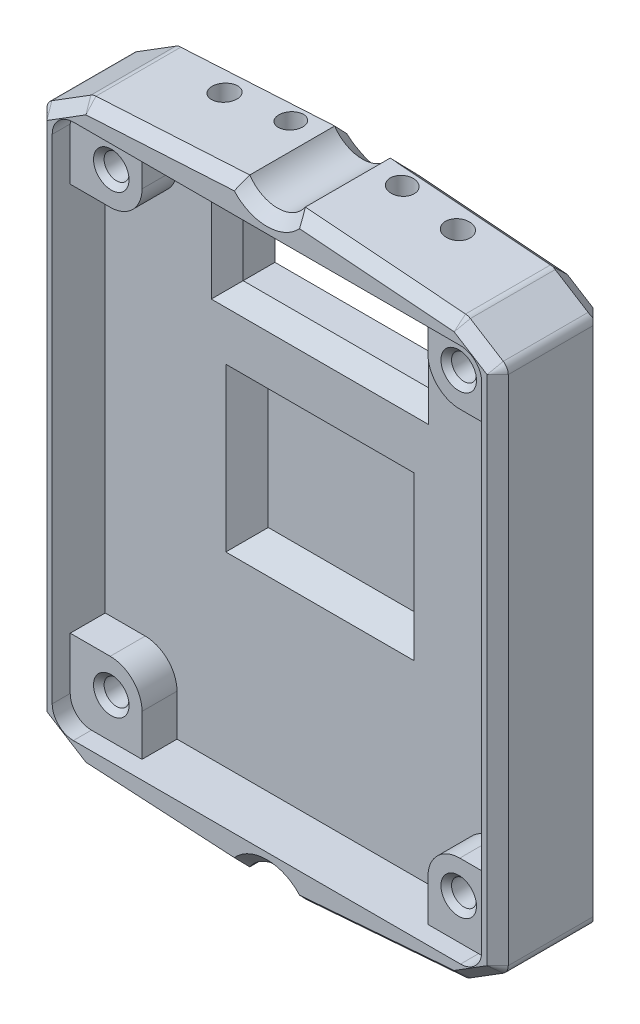
from build123d import *
from OCP.BRepFilletAPI import BRepFilletAPI_MakeChamfer

# Parameters (mm, degrees)
SKETCH1_W               = 46.5
SKETCH1_H               = 56.5
SKETCH1_W_2             = 40.5
SKETCH1_H_2             = 50.5
BOSS_EXTRUDE1_DEPTH     = 5
SKETCH2_W               = 46.5
SKETCH2_H               = 56.5
BOSS_EXTRUDE2_DEPTH     = 6
SKETCH3_W               = 6.769354508
SKETCH3_H               = 6.917814105
SKETCH3_R               = 1.175
BOSS_EXTRUDE3_DEPTH     = 3.3
CHAMFER3_SIZE           = 4.5
CHAMFER3_SIZE2          = 7.201505381
FILLET1_R               = 3
SKETCH4_W               = 17.5
SKETCH4_H               = 10
CUT_EXTRUDE1_DEPTH      = 38.075935592
CUT_EXTRUDE2_DEPTH      = 39.205038935
SKETCH6_W               = 1.5
SKETCH6_H               = 60.377235873
CUT_EXTRUDE3_DEPTH      = 39.205038935
CUT_EXTRUDE4_START      = 30
SKETCH7_R               = 1.125
CUT_EXTRUDE4_DEPTH      = 10
CHAMFER6_SIZE           = 2
FILLET2_R               = 1
CHAMFER1_SIZE           = 1
FILLET3_R               = 2
SKETCH8_R               = 1.175
CUT_EXTRUDE5_DEPTH      = 37.84601894
CUT_EXTRUDE6_DEPTH      = 1
CHAMFER2_SIZE           = 0.5
CHAMFER4_SIZE           = 1
CUT_EXTRUDE7_DEPTH      = 37.154378873
CUT_EXTRUDE7_DEPTH_BACK = 37.154378873
SKETCH10_R              = 1.175
SKETCH11_W              = 17.761064334
SKETCH11_H              = 15.333216528
CUT_EXTRUDE8_DEPTH      = 2
CHAMFER5_SIZE           = 2
CHAMFER7_SIZE           = 1.5


# Some blends are built 0.0001 mm under size
with BuildPart() as part:
    # Sketch1 → Boss-Extrude1 (new body)
    with BuildSketch(Plane.XY):
        Rectangle(SKETCH1_W, SKETCH1_H)
        Rectangle(SKETCH1_W_2, SKETCH1_H_2, mode=Mode.SUBTRACT)
    extrude(amount=BOSS_EXTRUDE1_DEPTH)

    # Sketch2 → Boss-Extrude2 (add)
    with BuildSketch(Plane(origin=(0, 0, 0), x_dir=(-1, 0, 0), z_dir=(0, 0, -1))):
        Rectangle(SKETCH2_W, SKETCH2_H)
    extrude(amount=BOSS_EXTRUDE2_DEPTH)

    # Sketch3 → Boss-Extrude3 (add)
    # profile 1 of 4: a face of its own
    with BuildSketch(Plane.XY):
        with Locations((-16.865322746, 21.791092948)):
            Rectangle(SKETCH3_W, SKETCH3_H)
        with Locations((-16.38, 21.46)):
            Circle(SKETCH3_R, mode=Mode.SUBTRACT)
    # profile 2 of 4: a face of its own
    with BuildSketch(Plane.XY):
        with Locations((16.865322746, 21.791092948)):
            Rectangle(SKETCH3_W, SKETCH3_H)
        with Locations(Location((16.38, 21.46, 0), (0, 0, 180))):
            Circle(SKETCH3_R, mode=Mode.SUBTRACT)
    # profile 3 of 4: a face of its own
    with BuildSketch(Plane.XY):
        with Locations((16.865322746, -21.791092948)):
            Rectangle(SKETCH3_W, SKETCH3_H)
        with Locations((16.38, -21.46)):
            Circle(SKETCH3_R, mode=Mode.SUBTRACT)
    # profile 4 of 4: a face of its own
    with BuildSketch(Plane.XY):
        with Locations((-16.865322746, -21.791092948)):
            Rectangle(SKETCH3_W, SKETCH3_H)
        with Locations(Location((-16.38, -21.46, 0), (0, 0, 180))):
            Circle(SKETCH3_R, mode=Mode.SUBTRACT)
    extrude(amount=BOSS_EXTRUDE3_DEPTH)

    # Chamfer3: one chamfer whose edges measure the first distance from different faces: ONE call of the kernel's chamfer builder (chamfer() names one face for all edges)
    chamfer3_edges_1 = [part.edges().sort_by_distance(p)[0] for p in [
        (23.25, 28.25, -0.5),
        (23.25, -28.25, -0.5),
    ]]
    chamfer3_side_1 = [part.faces().sort_by_distance(p)[0] for p in [
        (23.25, 0, -0.5),
    ]]
    chamfer3_edges_2 = [part.edges().sort_by_distance(p)[0] for p in [
        (-23.25, -28.25, -0.5),
        (-23.25, 28.25, -0.5),
    ]]
    chamfer3_side_2 = [part.faces().sort_by_distance(p)[0] for p in [
        (-23.25, 0, -0.5),
    ]]
    chamfer3 = BRepFilletAPI_MakeChamfer(part.part.solid().wrapped)
    for e in chamfer3_edges_1:
        chamfer3.Add(CHAMFER3_SIZE, CHAMFER3_SIZE2, e.wrapped, chamfer3_side_1[0].wrapped)  # the first distance lies on this face
    for e in chamfer3_edges_2:
        chamfer3.Add(CHAMFER3_SIZE, CHAMFER3_SIZE2, e.wrapped, chamfer3_side_2[0].wrapped)  # the first distance lies on this face
    add(Compound.cast(chamfer3.Shape()), mode=Mode.REPLACE)

    # Fillet1
    fillet1_edges = [part.edges().sort_by_distance(p)[0] for p in [
        (-13.480645492, 18.332185895, 1.65),
        (13.480645492, 18.332185895, 1.65),
        (13.480645492, -18.332185895, 1.65),
        (-13.480645492, -18.332185895, 1.65),
    ]]
    fillet(fillet1_edges, radius=FILLET1_R)

    # Sketch4 → Cut-Extrude1 (cut, through all)
    with BuildSketch(Plane.XY):
        with Locations((0, 18.8)):
            Rectangle(SKETCH4_W, SKETCH4_H)
    extrude(amount=-CUT_EXTRUDE1_DEPTH, mode=Mode.SUBTRACT)

    # Sketch5 → Cut-Extrude2 (cut, through all)
    with BuildSketch(Plane(origin=(0, 0, -6), x_dir=(-1, 0, 0), z_dir=(0, 0, -1))):
        Polygon((-23.25, -26.637996363), (-23.25, -28.25), (-16.048494619, -28.25), (-17.967727773, -27.050730023), align=None)
        with BuildLine():
            ThreePointArc((2.619160171, -28.25), (0, -26.85), (-2.619160171, -28.25))
            Line((-2.619160171, -28.25), (2.619160171, -28.25))
        make_face()
        Polygon((17.383051154, -27.416076523), (16.048494619, -28.25), (23.25, -28.25), (23.25, -27.08468784), align=None)
        Polygon((-17.967727773, -27.050730023), (-16.048494619, -28.25), (-2.619160171, -28.25), align=None)
        Polygon((17.383051154, -27.416076523), (2.619160171, -28.25), (16.048494619, -28.25), align=None)
        Polygon((-17.967727773, 27.050730023), (-2.619160171, 28.25), (-16.048494619, 28.25), align=None)
        Polygon((16.048494619, 28.25), (2.619160171, 28.25), (17.383051154, 27.416076523), align=None)
        Polygon((16.048494619, 28.25), (17.383051154, 27.416076523), (23.25, 27.08468784), (23.25, 28.25), align=None)
        Polygon((-23.25, 26.637996363), (-17.967727773, 27.050730023), (-16.048494619, 28.25), (-23.25, 28.25), align=None)
        with BuildLine():
            Line((2.619160171, 28.25), (-2.619160171, 28.25))
            ThreePointArc((-2.619160171, 28.25), (0, 26.85), (2.619160171, 28.25))
        make_face()
    extrude(amount=-CUT_EXTRUDE2_DEPTH, mode=Mode.SUBTRACT)

    # Sketch6 → Cut-Extrude3 (cut, through all)
    with BuildSketch(Plane.XY.offset(5)):
        with Locations((-22.500324405, 3.019222435)):
            Rectangle(SKETCH6_W, SKETCH6_H)
        with Locations((22.500324405, 3.019222435)):
            Rectangle(SKETCH6_W, SKETCH6_H)
    extrude(amount=-CUT_EXTRUDE3_DEPTH, mode=Mode.SUBTRACT)

    # Sketch7 → Cut-Extrude4 (cut)
    with BuildSketch(Plane(origin=(0, 0, 0), x_dir=(1, 0, 0), z_dir=(0, 1, 0)).offset(CUT_EXTRUDE4_START)):
        with Locations((-5.25, 2.5)):
            Circle(SKETCH7_R)
        with Locations(Location((5.25, 2.5, 0), (0, 0, 180))):
            Circle(SKETCH7_R)
    cut_extrude4 = extrude(amount=-CUT_EXTRUDE4_DEPTH, mode=Mode.SUBTRACT)

    # Mirror1: Cut-Extrude4 across plane
    add(cut_extrude4.mirror(Plane.ZX), mode=Mode.SUBTRACT)

    # Chamfer6
    chamfer6_edges = [part.edges().sort_by_distance(p)[0] for p in [
        (0, -26.85, -6),
        (0, 26.85, -6),
        (19.859026089, 25.86891567, -6),
        (-19.56668778, -26.05158892, -6),
        (-10.001105663, -27.833038261, -6),
        (10.293443972, -27.650365012, -6),
        (10.293443972, 27.650365012, -6),
        (-10.001105663, 27.833038261, -6),
        (19.859026089, -25.86891567, -6),
        (-19.56668778, 26.05158892, -6),
        (-21.750324405, 0, -6),
        (21.750324405, 0, -6),
    ]]
    chamfer(chamfer6_edges, length=CHAMFER6_SIZE)

    # Fillet2
    fillet2_edges = [part.edges().sort_by_distance(p)[0] for p in [
        (-17.383051154, -27.416076523, 0.5),
        (17.967727773, -27.050730023, 0.5),
        (17.967727773, 27.050730023, 0.5),
        (-17.383051154, 27.416076523, 0.5),
        (-21.750324405, 24.687101317, 0.5),
        (21.750324405, -24.687101317, 0.5),
        (-21.750324405, -24.687101317, 0.5),
        (21.750324405, 24.687101317, 0.5),
    ]]
    fillet(fillet2_edges, radius=FILLET2_R)

    # Chamfer1
    # the kernel refuses this chamfer: 1 mm, written as the material it takes off along each edge
    with BuildSketch(Plane(origin=(0, -30, 5), x_dir=(-0.9741455172104229, -0.22592147153123326, 0), z_dir=(0.22592147153123326, -0.9741455172104229, 0))) as chamfer1_piece_1:
        Polygon((3.15 + CHAMFER1_SIZE, 0), (3.15, CHAMFER1_SIZE), (3.15, 0), align=None)
    revolve(axis=Axis((0, -30, 5), (0, 0, -1)), revolution_arc=206.11413982, mode=Mode.SUBTRACT)
    with BuildSketch(Plane(origin=(0, 30, 5), x_dir=(0.9741455172104218, 0.22592147153123757, 0), z_dir=(-0.22592147153123757, 0.9741455172104218, 0))) as chamfer1_piece_2:
        Polygon((3.15 + CHAMFER1_SIZE, 0), (3.15, CHAMFER1_SIZE), (3.15, 0), align=None)
    revolve(axis=Axis((0, 30, 5), (0, 0, -1)), revolution_arc=206.11413982, mode=Mode.SUBTRACT)
    with BuildSketch(Plane(origin=(-21.280243669, 24.980840362, 5), x_dir=(0, 0, -1), z_dir=(0.8480480961564273, 0.5299192642332029, 0)), Plane(origin=(-21.280243669, -24.980840362, 5), x_dir=(0.5299192642332029, 0.8480480961564274, 0), z_dir=(0.8480480961564274, -0.5299192642332028, 0))) as chamfer1_piece_3:
        Polygon((CHAMFER1_SIZE, 0), (0, -CHAMFER1_SIZE), (0, 0), align=None)
    extrude(amount=4.339034518, mode=Mode.SUBTRACT)
    with BuildSketch(Plane(origin=(-17.127008544, 27.430538831, 5), x_dir=(0.056394101048406496, -0.9984085863848238, 0), z_dir=(0.9984085863848239, 0.05639410104840651, 0)), Plane(origin=(-0.051569794, -28.39502775, 5), x_dir=(0.05639410104840633, 0.9984085863848238, 0), z_dir=(-0.9984085863848238, 0.05639410104840633, 0))) as chamfer1_piece_4:
        Polygon((CHAMFER1_SIZE, 0), (0, CHAMFER1_SIZE), (0, 0), align=None)
    extrude(amount=17.10265615, mode=Mode.SUBTRACT)
    with BuildSketch(Plane(origin=(-21.750324405, 24.132792266, 5), x_dir=(1, 0, 0), z_dir=(0, -1, 0))) as chamfer1_piece_5:
        Polygon((CHAMFER1_SIZE, 0), (0, -CHAMFER1_SIZE), (0, 0), align=None)
    extrude(amount=48.265584531, mode=Mode.SUBTRACT)
    with BuildSketch(Plane(origin=(17.723475622, -27.069814818, 5), x_dir=(-0.07789819925091969, 0.9969613184840543, 0), z_dir=(-0.9969613184840543, -0.07789819925091969, 0)), Plane(origin=(0.055291708, 28.450329474, 5), x_dir=(-0.07789819925091988, -0.9969613184840543, 0), z_dir=(0.9969613184840543, -0.0778981992509199, 0))) as chamfer1_piece_6:
        Polygon((CHAMFER1_SIZE, 0), (0, CHAMFER1_SIZE), (0, 0), align=None)
    extrude(amount=17.722035536, mode=Mode.SUBTRACT)
    with BuildSketch(Plane(origin=(21.280243669, -24.980840362, 5), x_dir=(-0.5299192642332028, 0.8480480961564273, 0), z_dir=(-0.8480480961564274, -0.5299192642332029, 0))) as chamfer1_piece_7:
        Polygon((CHAMFER1_SIZE, 0), (0, CHAMFER1_SIZE), (0, 0), align=None)
    extrude(amount=3.661050589, mode=Mode.SUBTRACT)
    with BuildSketch(Plane(origin=(21.750324405, 24.132792266, 5), x_dir=(-1, 0, 0), z_dir=(0, -1, 0))) as chamfer1_piece_8:
        Polygon((CHAMFER1_SIZE, 0), (0, CHAMFER1_SIZE), (0, 0), align=None)
    extrude(amount=48.265584531, mode=Mode.SUBTRACT)
    with BuildSketch(Plane(origin=(21.280243669, 24.980840362, 5), x_dir=(-0.529919264233203, -0.8480480961564272, 0), z_dir=(-0.8480480961564272, 0.529919264233203, 0))) as chamfer1_piece_9:
        Polygon((CHAMFER1_SIZE, 0), (0, -CHAMFER1_SIZE), (0, 0), align=None)
    extrude(amount=3.661050589, mode=Mode.SUBTRACT)
    with BuildSketch(Plane(origin=(20.750324405, 24.132792266, 5), x_dir=(0.5299192642332002, 0.848048096156429, 0), z_dir=(-0.848048096156429, 0.5299192642332002, 0))) as chamfer1_piece_10:
        Polygon((1 - CHAMFER1_SIZE, 0), (1, CHAMFER1_SIZE), (1, 0), align=None)
    revolve(axis=Axis((20.750324405, 24.132792266, 5), (0, 0, -1)), revolution_arc=58, mode=Mode.SUBTRACT)
    with BuildSketch(Plane(origin=(-20.750324405, 24.132792266, 5), x_dir=(-0.5299192642332002, 0.848048096156429, 0), z_dir=(0.848048096156429, 0.5299192642332002, 0))) as chamfer1_piece_11:
        Polygon((1, -CHAMFER1_SIZE), (1 - CHAMFER1_SIZE, 0), (1, 0), align=None)
    revolve(axis=Axis((-20.750324405, 24.132792266, 5), (0, 0, 1)), revolution_arc=58, mode=Mode.SUBTRACT)
    with BuildSketch(Plane(origin=(-20.750324405, -24.132792266, 5), x_dir=(-1, 0, 0), z_dir=(0, 1, 0))) as chamfer1_piece_12:
        Polygon((1 - CHAMFER1_SIZE, 0), (1, -CHAMFER1_SIZE), (1, 0), align=None)
    revolve(axis=Axis((-20.750324405, -24.132792266, 5), (0, 0, 1)), revolution_arc=58, mode=Mode.SUBTRACT)
    with BuildSketch(Plane(origin=(-17.070614443, -26.432130245, 5), x_dir=(-0.05639410104840797, -0.9984085863848238, 0), z_dir=(0.9984085863848238, -0.05639410104840797, 0))) as chamfer1_piece_13:
        Polygon((1 - CHAMFER1_SIZE, 0), (1, CHAMFER1_SIZE), (1, 0), align=None)
    revolve(axis=Axis((-17.070614443, -26.432130245, 5), (0, 0, -1)), revolution_arc=28.7671409, mode=Mode.SUBTRACT)
    with BuildSketch(Plane(origin=(17.645577423, -26.0728535, 5), x_dir=(0.5299192642332029, -0.8480480961564274, 0), z_dir=(0.8480480961564274, 0.5299192642332029, 0))) as chamfer1_piece_14:
        Polygon((1 - CHAMFER1_SIZE, 0), (1, CHAMFER1_SIZE), (1, 0), align=None)
    revolve(axis=Axis((17.645577423, -26.0728535, 5), (0, 0, -1)), revolution_arc=27.532235663, mode=Mode.SUBTRACT)
    with BuildSketch(Plane(origin=(20.750324405, -24.132792266, 5), x_dir=(1, 0, 0), z_dir=(0, 1, 0))) as chamfer1_piece_15:
        Polygon((1 - CHAMFER1_SIZE, 0), (1, CHAMFER1_SIZE), (1, 0), align=None)
    revolve(axis=Axis((20.750324405, -24.132792266, 5), (0, 0, -1)), revolution_arc=58, mode=Mode.SUBTRACT)
    with BuildSketch(Plane(origin=(17.645577423, 26.0728535, 5), x_dir=(0.07789819925092091, 0.9969613184840542, 0), z_dir=(-0.9969613184840542, 0.07789819925092091, 0))) as chamfer1_piece_16:
        Polygon((1 - CHAMFER1_SIZE, 0), (1, CHAMFER1_SIZE), (1, 0), align=None)
    revolve(axis=Axis((17.645577423, 26.0728535, 5), (0, 0, -1)), revolution_arc=27.532235663, mode=Mode.SUBTRACT)
    with BuildSketch(Plane(origin=(-17.070614443, 26.432130245, 5), x_dir=(-0.5299192642332002, 0.848048096156429, 0), z_dir=(-0.848048096156429, -0.5299192642332002, 0))) as chamfer1_piece_17:
        Polygon((1, CHAMFER1_SIZE), (1 - CHAMFER1_SIZE, 0), (1, 0), align=None)
    revolve(axis=Axis((-17.070614443, 26.432130245, 5), (0, 0, -1)), revolution_arc=28.7671409, mode=Mode.SUBTRACT)

    # Fillet3
    # the kernel refuses this fillet: 2 mm, written as the material it adds along each edge
    with BuildSketch(Plane(origin=(-20.25, -25.25, -1.7), x_dir=(0, 1, 0), z_dir=(0, 0, 1))) as fillet3_piece_1_section:
        with BuildLine():
            CenterArc((FILLET3_R, -FILLET3_R), FILLET3_R, 90, 90)
            Line((0, -FILLET3_R), (0, 0))
            Line((0, 0), (FILLET3_R, 0))
        make_face()
    fillet3_piece_1 = extrude(amount=11.017685648, mode=Mode.PRIVATE)
    fillet3_piece_1 = split(fillet3_piece_1, bisect_by=Plane(origin=(-20.25, -25.25, 5), z_dir=(0, 0, -1)), keep=Keep.TOP, mode=Mode.PRIVATE)
    fillet3_piece_1 = split(fillet3_piece_1, bisect_by=Plane(origin=(-21.844443776, -27.801643429, 1.308842824), z_dir=(0.3747095052207162, 0.5996605595645308, -0.7071067811865475)), keep=Keep.TOP, mode=Mode.PRIVATE)
    add(fillet3_piece_1)
    with BuildSketch(Plane(origin=(20.25, -25.25, -1.7), x_dir=(-1, 0, 0), z_dir=(0, 0, 1))) as fillet3_piece_2_section:
        with BuildLine():
            CenterArc((FILLET3_R, -FILLET3_R), FILLET3_R, 90, 90)
            Line((0, -FILLET3_R), (0, 0))
            Line((0, 0), (FILLET3_R, 0))
        make_face()
    fillet3_piece_2 = extrude(amount=11.017685648, mode=Mode.PRIVATE)
    fillet3_piece_2 = split(fillet3_piece_2, bisect_by=Plane(origin=(20.25, -25.25, 5), z_dir=(0, 0, -1)), keep=Keep.TOP, mode=Mode.PRIVATE)
    fillet3_piece_2 = split(fillet3_piece_2, bisect_by=Plane(origin=(21.844443776, -27.801643429, 1.308842824), z_dir=(-0.37470950522071644, 0.5996605595645308, -0.7071067811865477)), keep=Keep.TOP, mode=Mode.PRIVATE)
    add(fillet3_piece_2)
    with BuildSketch(Plane(origin=(20.25, 25.25, -1.7), x_dir=(-1, 0, 0), z_dir=(0, 0, 1))) as fillet3_piece_3_section:
        with BuildLine():
            CenterArc((FILLET3_R, FILLET3_R), FILLET3_R, 180, 90)
            Line((0, FILLET3_R), (0, 0))
            Line((0, 0), (FILLET3_R, 0))
        make_face()
    fillet3_piece_3 = extrude(amount=11.017685648, mode=Mode.PRIVATE)
    fillet3_piece_3 = split(fillet3_piece_3, bisect_by=Plane(origin=(21.844443776, 27.801643429, 1.308842824), z_dir=(-0.37470950522071644, -0.5996605595645308, -0.7071067811865477)), keep=Keep.TOP, mode=Mode.PRIVATE)
    fillet3_piece_3 = split(fillet3_piece_3, bisect_by=Plane(origin=(20.25, 25.25, 5), z_dir=(0, 0, -1)), keep=Keep.TOP, mode=Mode.PRIVATE)
    add(fillet3_piece_3)
    with BuildSketch(Plane(origin=(-20.25, 25.25, -1.7), x_dir=(0, -1, 0), z_dir=(0, 0, 1))) as fillet3_piece_4_section:
        with BuildLine():
            CenterArc((FILLET3_R, FILLET3_R), FILLET3_R, 180, 90)
            Line((0, FILLET3_R), (0, 0))
            Line((0, 0), (FILLET3_R, 0))
        make_face()
    fillet3_piece_4 = extrude(amount=11.017685648, mode=Mode.PRIVATE)
    fillet3_piece_4 = split(fillet3_piece_4, bisect_by=Plane(origin=(-21.844443776, 27.801643429, 1.308842824), z_dir=(0.3747095052207162, -0.5996605595645308, -0.7071067811865475)), keep=Keep.TOP, mode=Mode.PRIVATE)
    fillet3_piece_4 = split(fillet3_piece_4, bisect_by=Plane(origin=(-20.25, 25.25, 5), z_dir=(0, 0, -1)), keep=Keep.TOP, mode=Mode.PRIVATE)
    add(fillet3_piece_4)

    # Sketch8 → Cut-Extrude5 (cut, through all)
    with BuildSketch(Plane.XY.offset(3.3)):
        with Locations((-16.38, 21.46)):
            Circle(SKETCH8_R)
        with Locations(Location((16.38, 21.46, 0), (0, 0, 180))):
            Circle(SKETCH8_R)
        with Locations((16.38, -21.46)):
            Circle(SKETCH8_R)
        with Locations(Location((-16.38, -21.46, 0), (0, 0, 180))):
            Circle(SKETCH8_R)
    extrude(amount=-CUT_EXTRUDE5_DEPTH, mode=Mode.SUBTRACT)

    # Sketch9 → Cut-Extrude6 (cut)
    with BuildSketch(Plane(origin=(0, 0, -6), x_dir=(-1, 0, 0), z_dir=(0, 0, -1))):
        with BuildLine():
            Line((-16.374158343, -2.036488248), (-6.384848004, -2.036488248))
            ThreePointArc((-6.384848004, -2.036488248), (-1.5, -2.786488248), (-6.384848004, -3.536488248))
            Line((-6.384848004, -3.536488248), (-12.618681454, -3.536488248))
            Line((-12.618681454, -3.536488248), (0, -15.530095236))
            Line((0, -15.530095236), (12.618681454, -3.536488248))
            Line((12.618681454, -3.536488248), (6.384848004, -3.536488248))
            ThreePointArc((6.384848004, -3.536488248), (1.5, -2.786488248), (6.384848004, -2.036488248))
            Line((6.384848004, -2.036488248), (16.374158343, -2.036488248))
            Line((16.374158343, -2.036488248), (0, -17.599542173))
            Line((0, -17.599542173), (-16.374158343, -2.036488248))
        make_face()
    extrude(amount=-CUT_EXTRUDE6_DEPTH, mode=Mode.SUBTRACT)

    # Chamfer2
    chamfer2_edges = [part.edges().sort_by_distance(p)[0] for p in [
        (-17.555, 21.46, 3.3),
        (17.555, 21.46, 3.3),
        (15.205, -21.46, 3.3),
        (-15.205, -21.46, 3.3),
    ]]
    chamfer(chamfer2_edges, length=CHAMFER2_SIZE)

    # Chamfer4
    chamfer4_edges = [part.edges().sort_by_distance(p)[0] for p in [
        (-8.187079171, -9.81801521, -6),
        (-11.379503173, -2.036488248, -6),
        (-1.5, -2.786488248, -6),
        (-9.501764729, -3.536488248, -6),
        (-6.309340727, -9.533291742, -6),
        (6.309340727, -9.533291742, -6),
        (9.501764729, -3.536488248, -6),
        (1.5, -2.786488248, -6),
        (11.379503173, -2.036488248, -6),
        (8.187079171, -9.81801521, -6),
    ]]
    chamfer(chamfer4_edges, length=CHAMFER4_SIZE - 0.0001)  # a hair under: the kernel refuses the full size

    # Sketch10 → Cut-Extrude7 (cut, two sides: drawn at the far end of the back side and taken through both)
    with BuildSketch(Plane(origin=(0, 0, 0), x_dir=(1, 0, 0), z_dir=(0, 1, 0)).offset(-CUT_EXTRUDE7_DEPTH_BACK)):
        with Locations((-11, 2)):
            Circle(SKETCH10_R)
        with Locations((11, 2)):
            Circle(SKETCH10_R)
    extrude(amount=CUT_EXTRUDE7_DEPTH + CUT_EXTRUDE7_DEPTH_BACK, mode=Mode.SUBTRACT)

    # Sketch11 → Cut-Extrude8 (cut)
    with BuildSketch(Plane.XY):
        Rectangle(SKETCH11_W, SKETCH11_H)
    extrude(amount=-CUT_EXTRUDE8_DEPTH, mode=Mode.SUBTRACT)

    # Chamfer5
    chamfer5_edges = [part.edges().sort_by_distance(p)[0] for p in [
        (0, -7.666608264, -2),
        (-8.880532167, 0, -2),
        (0, 7.666608264, -2),
        (8.880532167, 0, -2),
    ]]
    chamfer(chamfer5_edges, length=CHAMFER5_SIZE - 0.0001)  # a hair under: the kernel refuses the full size

    # Chamfer7
    # the kernel refuses this chamfer: 1.5 mm, written as the material it takes off along each edge
    with BuildSketch(Plane(origin=(-8.75, 13.8, -6), x_dir=(0, 0, 1), z_dir=(0, 1, 0)), Plane(origin=(8.75, 23.8, -6), x_dir=(0, 0, 1), z_dir=(0, -1, 0)), Plane(origin=(-8.75, 13.8, 0), x_dir=(-1, 0, 0), z_dir=(0, 1, 0)), Plane(origin=(8.75, 23.8, 0), x_dir=(1, 0, 0), z_dir=(0, -1, 0))) as chamfer7_piece_1:
        Polygon((CHAMFER7_SIZE, 0), (0, -CHAMFER7_SIZE), (0, 0), align=None)
    extrude(amount=10, mode=Mode.SUBTRACT)
    with BuildSketch(Plane(origin=(-8.75, 23.8, -6), x_dir=(0, 0, 1), z_dir=(1, 0, 0)), Plane(origin=(8.75, 13.8, -6), x_dir=(0, 0, 1), z_dir=(-1, 0, 0)), Plane(origin=(8.75, 13.8, 0), x_dir=(0, -1, 0), z_dir=(-1, 0, 0))) as chamfer7_piece_2:
        Polygon((CHAMFER7_SIZE, 0), (0, -CHAMFER7_SIZE), (0, 0), align=None)
    extrude(amount=17.5, mode=Mode.SUBTRACT)
    with BuildSketch(Plane(origin=(-8.75, 23.8, 0), x_dir=(0, 1, 0), z_dir=(1, 0, 0))) as chamfer7_piece_3_section:
        Polygon((CHAMFER7_SIZE, 0), (0, -CHAMFER7_SIZE), (0, 0), align=None)
    chamfer7_piece_3 = extrude(amount=17.5, mode=Mode.PRIVATE)
    chamfer7_piece_3 = split(chamfer7_piece_3, bisect_by=Plane(origin=(-8.75, 25.25, 0), z_dir=(0, -1, 0)), keep=Keep.TOP, mode=Mode.PRIVATE)
    add(chamfer7_piece_3, mode=Mode.SUBTRACT)
    with BuildSketch(Plane(origin=(-8.75, 9.942475518, -6), x_dir=(0, 0, 1), z_dir=(0, 1, 0))) as chamfer7_piece_4a_section:
        Polygon((CHAMFER7_SIZE, 0), (0, -CHAMFER7_SIZE), (0, 0), align=None)
    chamfer7_piece_4a = extrude(amount=13.857524482, mode=Mode.PRIVATE)
    chamfer7_piece_4a = split(chamfer7_piece_4a, bisect_by=Plane(origin=(-8.75, 13.8, -6), z_dir=(0, -1, 0)), keep=Keep.TOP, mode=Mode.PRIVATE)
    with BuildSketch(Plane(origin=(8.75, 13.8, -6), x_dir=(0, 0, 1), z_dir=(-1, 0, 0))) as chamfer7_piece_4b_section:
        Polygon((CHAMFER7_SIZE, 0), (0, -CHAMFER7_SIZE), (0, 0), align=None)
    chamfer7_piece_4b = extrude(amount=21.357524482, mode=Mode.PRIVATE)
    chamfer7_piece_4b = split(chamfer7_piece_4b, bisect_by=Plane(origin=(-8.75, 13.8, -6), z_dir=(-1, 0, 0)), keep=Keep.TOP, mode=Mode.PRIVATE)
    chamfer7_piece_4 = chamfer7_piece_4a & chamfer7_piece_4b
    add(chamfer7_piece_4, mode=Mode.SUBTRACT)
    with BuildSketch(Plane(origin=(-8.75, 13.8, -6), x_dir=(0, 0, 1), z_dir=(0, 1, 0))) as chamfer7_piece_5a_section:
        Polygon((CHAMFER7_SIZE, 0), (0, -CHAMFER7_SIZE), (0, 0), align=None)
    chamfer7_piece_5a = extrude(amount=13.857524482, mode=Mode.PRIVATE)
    chamfer7_piece_5a = split(chamfer7_piece_5a, bisect_by=Plane(origin=(-8.75, 23.8, -6), z_dir=(0, 1, 0)), keep=Keep.TOP, mode=Mode.PRIVATE)
    with BuildSketch(Plane(origin=(-12.607524482, 23.8, -6), x_dir=(0, 0, 1), z_dir=(1, 0, 0))) as chamfer7_piece_5b_section:
        Polygon((CHAMFER7_SIZE, 0), (0, -CHAMFER7_SIZE), (0, 0), align=None)
    chamfer7_piece_5b = extrude(amount=21.357524482, mode=Mode.PRIVATE)
    chamfer7_piece_5b = split(chamfer7_piece_5b, bisect_by=Plane(origin=(-8.75, 23.8, -6), z_dir=(-1, 0, 0)), keep=Keep.TOP, mode=Mode.PRIVATE)
    chamfer7_piece_5 = chamfer7_piece_5a & chamfer7_piece_5b
    add(chamfer7_piece_5, mode=Mode.SUBTRACT)
    with BuildSketch(Plane(origin=(-8.75, 23.8, -6), x_dir=(0, 0, 1), z_dir=(1, 0, 0))) as chamfer7_piece_6a_section:
        Polygon((CHAMFER7_SIZE, 0), (0, -CHAMFER7_SIZE), (0, 0), align=None)
    chamfer7_piece_6a = extrude(amount=21.357524482, mode=Mode.PRIVATE)
    chamfer7_piece_6a = split(chamfer7_piece_6a, bisect_by=Plane(origin=(8.75, 23.8, -6), z_dir=(1, 0, 0)), keep=Keep.TOP, mode=Mode.PRIVATE)
    with BuildSketch(Plane(origin=(8.75, 27.657524482, -6), x_dir=(0, 0, 1), z_dir=(0, -1, 0))) as chamfer7_piece_6b_section:
        Polygon((CHAMFER7_SIZE, 0), (0, -CHAMFER7_SIZE), (0, 0), align=None)
    chamfer7_piece_6b = extrude(amount=13.857524482, mode=Mode.PRIVATE)
    chamfer7_piece_6b = split(chamfer7_piece_6b, bisect_by=Plane(origin=(8.75, 23.8, -6), z_dir=(0, 1, 0)), keep=Keep.TOP, mode=Mode.PRIVATE)
    chamfer7_piece_6 = chamfer7_piece_6a & chamfer7_piece_6b
    add(chamfer7_piece_6, mode=Mode.SUBTRACT)
    with BuildSketch(Plane(origin=(12.607524482, 13.8, -6), x_dir=(0, 0, 1), z_dir=(-1, 0, 0))) as chamfer7_piece_7a_section:
        Polygon((CHAMFER7_SIZE, 0), (0, -CHAMFER7_SIZE), (0, 0), align=None)
    chamfer7_piece_7a = extrude(amount=21.357524482, mode=Mode.PRIVATE)
    chamfer7_piece_7a = split(chamfer7_piece_7a, bisect_by=Plane(origin=(8.75, 13.8, -6), z_dir=(1, 0, 0)), keep=Keep.TOP, mode=Mode.PRIVATE)
    with BuildSketch(Plane(origin=(8.75, 23.8, -6), x_dir=(0, 0, 1), z_dir=(0, -1, 0))) as chamfer7_piece_7b_section:
        Polygon((CHAMFER7_SIZE, 0), (0, -CHAMFER7_SIZE), (0, 0), align=None)
    chamfer7_piece_7b = extrude(amount=13.857524482, mode=Mode.PRIVATE)
    chamfer7_piece_7b = split(chamfer7_piece_7b, bisect_by=Plane(origin=(8.75, 13.8, -6), z_dir=(0, -1, 0)), keep=Keep.TOP, mode=Mode.PRIVATE)
    chamfer7_piece_7 = chamfer7_piece_7a & chamfer7_piece_7b
    add(chamfer7_piece_7, mode=Mode.SUBTRACT)
    with BuildSketch(Plane(origin=(-8.75, 9.942475518, 0), x_dir=(-1, 0, 0), z_dir=(0, 1, 0))) as chamfer7_piece_8a_section:
        Polygon((CHAMFER7_SIZE, 0), (0, -CHAMFER7_SIZE), (0, 0), align=None)
    chamfer7_piece_8a = extrude(amount=13.857524482, mode=Mode.PRIVATE)
    chamfer7_piece_8a = split(chamfer7_piece_8a, bisect_by=Plane(origin=(-8.75, 13.8, 0), z_dir=(0, -1, 0)), keep=Keep.TOP, mode=Mode.PRIVATE)
    with BuildSketch(Plane(origin=(8.75, 13.8, 0), x_dir=(0, -1, 0), z_dir=(-1, 0, 0))) as chamfer7_piece_8b_section:
        Polygon((CHAMFER7_SIZE, 0), (0, -CHAMFER7_SIZE), (0, 0), align=None)
    chamfer7_piece_8b = extrude(amount=21.357524482, mode=Mode.PRIVATE)
    chamfer7_piece_8b = split(chamfer7_piece_8b, bisect_by=Plane(origin=(-8.75, 13.8, 0), z_dir=(-1, 0, 0)), keep=Keep.TOP, mode=Mode.PRIVATE)
    chamfer7_piece_8 = chamfer7_piece_8a & chamfer7_piece_8b
    add(chamfer7_piece_8, mode=Mode.SUBTRACT)
    with BuildSketch(Plane(origin=(-8.75, 13.8, 0), x_dir=(-1, 0, 0), z_dir=(0, 1, 0))) as chamfer7_piece_9a_section:
        Polygon((CHAMFER7_SIZE, 0), (0, -CHAMFER7_SIZE), (0, 0), align=None)
    chamfer7_piece_9a = extrude(amount=13.857524482, mode=Mode.PRIVATE)
    chamfer7_piece_9a = split(chamfer7_piece_9a, bisect_by=Plane(origin=(-8.75, 25.25, 0), z_dir=(0, -1, 0)), keep=Keep.TOP, mode=Mode.PRIVATE)
    chamfer7_piece_9a = split(chamfer7_piece_9a, bisect_by=Plane(origin=(-8.75, 23.8, 0), z_dir=(0, 1, 0)), keep=Keep.TOP, mode=Mode.PRIVATE)
    with BuildSketch(Plane(origin=(-12.607524482, 23.8, 0), x_dir=(0, 1, 0), z_dir=(1, 0, 0))) as chamfer7_piece_9b_section:
        Polygon((CHAMFER7_SIZE, 0), (0, -CHAMFER7_SIZE), (0, 0), align=None)
    chamfer7_piece_9b = extrude(amount=21.357524482, mode=Mode.PRIVATE)
    chamfer7_piece_9b = split(chamfer7_piece_9b, bisect_by=Plane(origin=(-12.607524482, 25.25, 0), z_dir=(0, -1, 0)), keep=Keep.TOP, mode=Mode.PRIVATE)
    chamfer7_piece_9b = split(chamfer7_piece_9b, bisect_by=Plane(origin=(-8.75, 23.8, 0), z_dir=(-1, 0, 0)), keep=Keep.TOP, mode=Mode.PRIVATE)
    chamfer7_piece_9 = chamfer7_piece_9a & chamfer7_piece_9b
    add(chamfer7_piece_9, mode=Mode.SUBTRACT)
    with BuildSketch(Plane(origin=(12.607524482, 13.8, 0), x_dir=(0, -1, 0), z_dir=(-1, 0, 0))) as chamfer7_piece_10a_section:
        Polygon((CHAMFER7_SIZE, 0), (0, -CHAMFER7_SIZE), (0, 0), align=None)
    chamfer7_piece_10a = extrude(amount=21.357524482, mode=Mode.PRIVATE)
    chamfer7_piece_10a = split(chamfer7_piece_10a, bisect_by=Plane(origin=(8.75, 13.8, 0), z_dir=(1, 0, 0)), keep=Keep.TOP, mode=Mode.PRIVATE)
    with BuildSketch(Plane(origin=(8.75, 23.8, 0), x_dir=(1, 0, 0), z_dir=(0, -1, 0))) as chamfer7_piece_10b_section:
        Polygon((CHAMFER7_SIZE, 0), (0, -CHAMFER7_SIZE), (0, 0), align=None)
    chamfer7_piece_10b = extrude(amount=13.857524482, mode=Mode.PRIVATE)
    chamfer7_piece_10b = split(chamfer7_piece_10b, bisect_by=Plane(origin=(8.75, 13.8, 0), z_dir=(0, -1, 0)), keep=Keep.TOP, mode=Mode.PRIVATE)
    chamfer7_piece_10 = chamfer7_piece_10a & chamfer7_piece_10b
    add(chamfer7_piece_10, mode=Mode.SUBTRACT)
    with BuildSketch(Plane(origin=(-8.75, 23.8, 0), x_dir=(0, 1, 0), z_dir=(1, 0, 0))) as chamfer7_piece_11a_section:
        Polygon((CHAMFER7_SIZE, 0), (0, -CHAMFER7_SIZE), (0, 0), align=None)
    chamfer7_piece_11a = extrude(amount=21.357524482, mode=Mode.PRIVATE)
    chamfer7_piece_11a = split(chamfer7_piece_11a, bisect_by=Plane(origin=(-8.75, 25.25, 0), z_dir=(0, -1, 0)), keep=Keep.TOP, mode=Mode.PRIVATE)
    chamfer7_piece_11a = split(chamfer7_piece_11a, bisect_by=Plane(origin=(8.75, 23.8, 0), z_dir=(1, 0, 0)), keep=Keep.TOP, mode=Mode.PRIVATE)
    with BuildSketch(Plane(origin=(8.75, 27.657524482, 0), x_dir=(1, 0, 0), z_dir=(0, -1, 0))) as chamfer7_piece_11b_section:
        Polygon((CHAMFER7_SIZE, 0), (0, -CHAMFER7_SIZE), (0, 0), align=None)
    chamfer7_piece_11b = extrude(amount=13.857524482, mode=Mode.PRIVATE)
    chamfer7_piece_11b = split(chamfer7_piece_11b, bisect_by=Plane(origin=(8.75, 25.25, 0), z_dir=(0, -1, 0)), keep=Keep.TOP, mode=Mode.PRIVATE)
    chamfer7_piece_11b = split(chamfer7_piece_11b, bisect_by=Plane(origin=(8.75, 23.8, 0), z_dir=(0, 1, 0)), keep=Keep.TOP, mode=Mode.PRIVATE)
    chamfer7_piece_11 = chamfer7_piece_11a & chamfer7_piece_11b
    add(chamfer7_piece_11, mode=Mode.SUBTRACT)


solid = part.part
